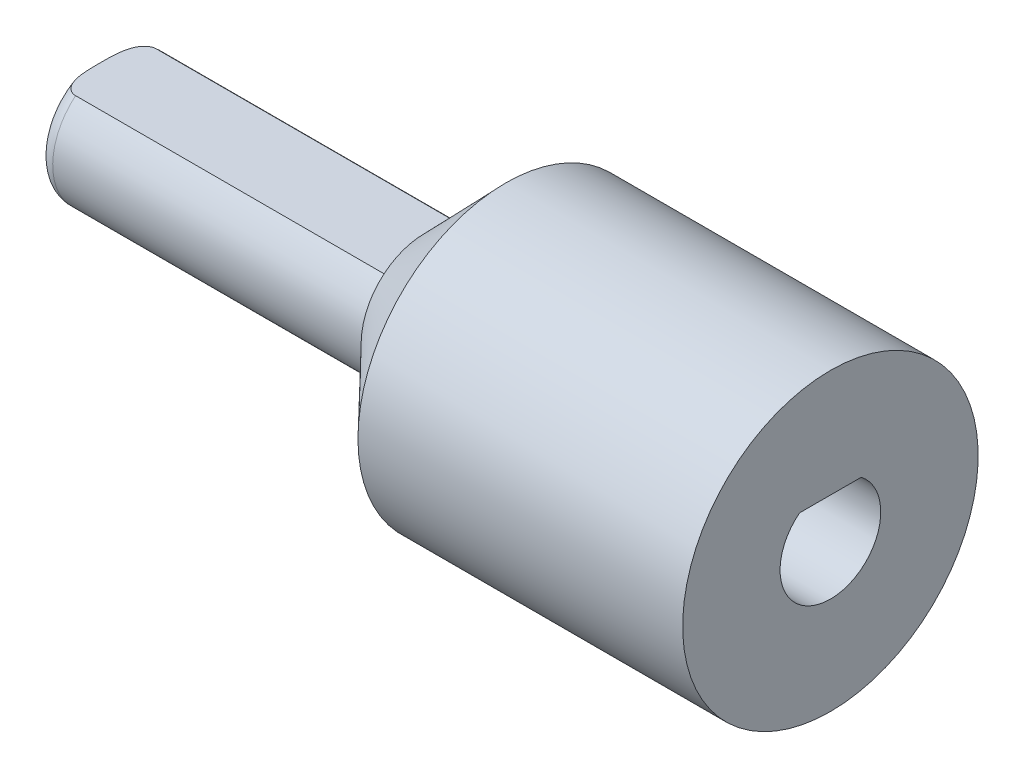
from build123d import *

# Parameters (mm, degrees)
BOSS_EXTRU_1_START      = -15
BOSS_EXTRU_1_DEPTH      = 15
ENL_V_START             = -20
ENL_V_MAT_EXTRU_1_DEPTH = 20


with BuildPart() as part:
    # Esquisse2 → Révolution1 (revolve)
    with BuildSketch(Plane.XY):
        Polygon((0, 0), (0, 3.9), (25, 3.9), (25, 9.1), (45, 9.1), (45, 3.1), (32, 3.1), (30, 0), align=None)
    revolve(axis=Axis((30, 0, 0), (-1, 0, 0)))

    # Esquisse3 → Révolution2 (revolve)
    with BuildSketch(Plane.XY, mode=Mode.PRIVATE) as r_volution2_sk:
        Polygon((25, 3.9), (20, 3.9), (25, 9.1), align=None)
    revolve(r_volution2_sk.sketch.rotate(Axis((0, 0, 0), (1, 0, 0)), 90), axis=Axis((0, 0, 0), (1, 0, 0)))

    # Esquisse4 → Boss.-Extru.1 (add)
    with BuildSketch(Plane(origin=(45, 0, 0), x_dir=(0, 0, -1), z_dir=(1, 0, 0)).offset(BOSS_EXTRU_1_START)):
        with BuildLine():
            ThreePointArc((1.899341991, 2.45), (0, 3.1), (-1.899341991, 2.45))
            Line((-1.899341991, 2.45), (1.899341991, 2.45))
        make_face()
    extrude(amount=BOSS_EXTRU_1_DEPTH)

    # Esquisse5 → Enlèv. mat.-Extru.1 (cut)
    with BuildSketch(Plane.ZY.offset(ENL_V_START)):
        with BuildLine():
            ThreePointArc((2.491987159, 3), (0, 3.9), (-2.491987159, 3))
            Line((-2.491987159, 3), (2.491987159, 3))
        make_face()
    extrude(amount=ENL_V_MAT_EXTRU_1_DEPTH, mode=Mode.SUBTRACT)

    # Congé2: read off the stored shape, not the designer's step
    # Congé2 outline → Congé2 (revolve, cut)
    with BuildSketch(Plane.YX):
        with BuildLine():
            Line((3.9, 0), (3.9, 1))
            ThreePointArc((3.9, 1), (3.607106781, 0.292893219), (2.9, 0))
            Line((2.9, 0), (3.9, 0))
        make_face()
    revolve(axis=Axis((0, 0, 0), (1, 0, 0)), mode=Mode.SUBTRACT)


solid = part.part
